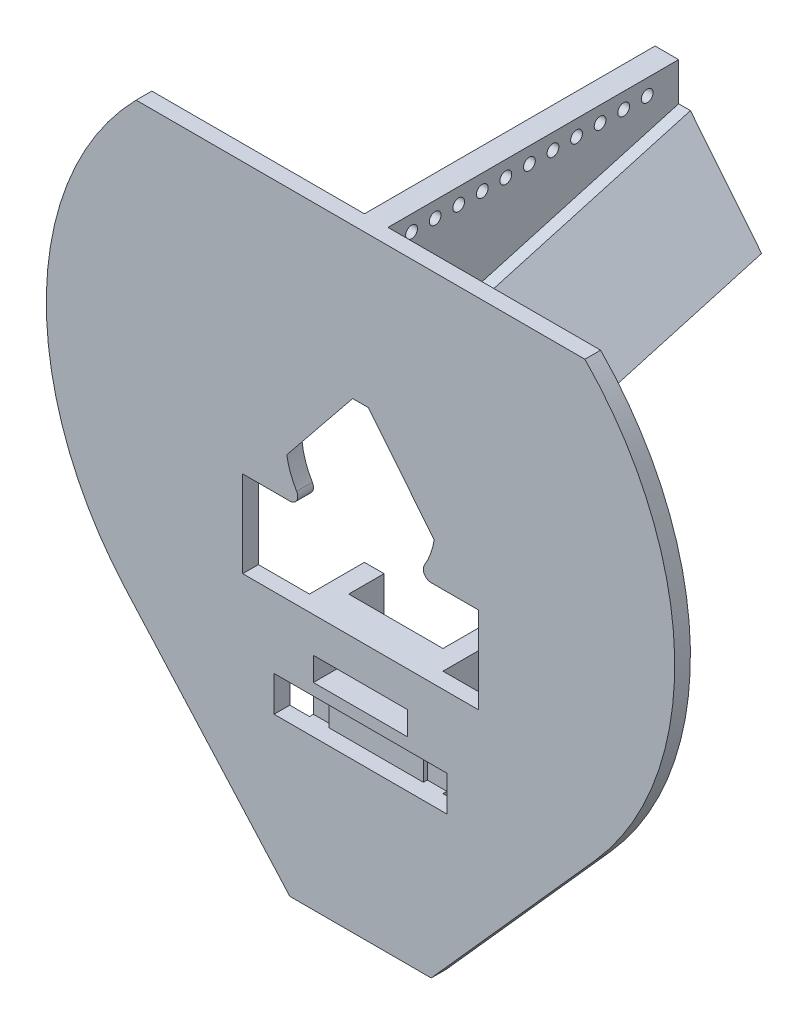
from build123d import *

# Parameters (mm, degrees)
BOSS_EXTRUDE1_DEPTH             = 2
SKETCH2_R                       = 0.75
BOSS_EXTRUDE2_DEPTH             = 1.5
BOSS_EXTRUDE3_REACH             = 75.225
BOSS_EXTRUDE3_DIRECTION_2_REACH = 75.225
CUT_EXTRUDE1_DEPTH              = 16.5
SKETCH5_W                       = 2.5
SKETCH5_H                       = 22
BOSS_EXTRUDE4_DEPTH             = 7
SKETCH6_W                       = 12
SKETCH6_H                       = 3
SKETCH6_W_2                     = 22
SKETCH6_H_2                     = 4.5
CUT_EXTRUDE2_DEPTH              = 2.5
SKETCH7_W                       = 12
SKETCH7_H                       = 7
SKETCH7_H_2                     = 4.5
BOSS_EXTRUDE5_DEPTH             = 2.5
FILLET1_R                       = 4
FILLET2_R                       = 1


with BuildPart() as part:
    # Sketch1 → Boss-Extrude1 (new body)
    with BuildSketch(Plane.XY):
        with BuildLine():
            Line((-28.565713714, 28), (28.565713714, 28))
            ThreePointArc((28.565713714, 28), (39.988956848, 0.93985647), (29.849608312, -26.627070504))
            Line((29.849608312, -26.627070504), (9, -50))
            Line((9, -50), (-9, -50))
            Line((-9, -50), (-29.849608312, -26.627070504))
            ThreePointArc((-29.849608312, -26.627070504), (-39.988956848, 0.93985647), (-28.565713714, 28))
        make_face()
        with BuildLine():
            Line((7, -6.422616289), (15, -6.422616289))
            Line((15, -6.422616289), (15, -17.422616289))
            Line((15, -17.422616289), (-15, -17.422616289))
            Line((-15, -17.422616289), (-15, -6.422616289))
            Line((-15, -6.422616289), (-7, -6.422616289))
            ThreePointArc((-7, -6.422616289), (0, 9.5), (7, -6.422616289))
        make_face(mode=Mode.SUBTRACT)
    extrude(amount=BOSS_EXTRUDE1_DEPTH)

    # Sketch2 → Boss-Extrude2 (add, symmetric)
    with BuildSketch(Plane(origin=(0, 0, 0), x_dir=(0, 0, -1), z_dir=(1, 0, 0))):
        Polygon((0, 9.5), (37, 20), (37, 28), (0, 28), align=None)
        with Locations((3, 26)):
            Circle(SKETCH2_R, mode=Mode.SUBTRACT)
        with Locations((6, 26)):
            Circle(SKETCH2_R, mode=Mode.SUBTRACT)
        with Locations((9, 26)):
            Circle(SKETCH2_R, mode=Mode.SUBTRACT)
        with Locations((12, 26)):
            Circle(SKETCH2_R, mode=Mode.SUBTRACT)
        with Locations((15, 26)):
            Circle(SKETCH2_R, mode=Mode.SUBTRACT)
        with Locations((18, 26)):
            Circle(SKETCH2_R, mode=Mode.SUBTRACT)
        with Locations((21, 26)):
            Circle(SKETCH2_R, mode=Mode.SUBTRACT)
        with Locations((24, 26)):
            Circle(SKETCH2_R, mode=Mode.SUBTRACT)
        with Locations((27, 26)):
            Circle(SKETCH2_R, mode=Mode.SUBTRACT)
        with Locations((30, 26)):
            Circle(SKETCH2_R, mode=Mode.SUBTRACT)
        with Locations((33, 26)):
            Circle(SKETCH2_R, mode=Mode.SUBTRACT)
    extrude(amount=BOSS_EXTRUDE2_DEPTH, both=True)

    # Boss-Extrude3: up to this plane
    boss_extrude3_end = Plane(origin=(1.5, 20, -37), z_dir=(0, 0, 1))
    # Sketch3 → Boss-Extrude3 (add, up to the surface)
    with BuildSketch(Plane(origin=(0, 0.708044617, -2.495014365), x_dir=(1, 0, 0), z_dir=(0, -0.27300368557463345, 0.9620129872629926)), mode=Mode.PRIVATE) as boss_extrude3_sk1:
        Polygon((1, 9.088350078), (-1, 9.088350078), (-9.380481154, -0.899118445), (-12.061636705, 1.350638189), (-3, 12.149876287), (3, 12.149876287), (12.061636705, 1.350638189), (9.380481154, -0.899118445), align=None)
    boss_extrude3_tool1 = split(extrude(boss_extrude3_sk1.sketch, amount=-BOSS_EXTRUDE3_REACH, mode=Mode.PRIVATE), bisect_by=boss_extrude3_end, keep=Keep.BOTH, mode=Mode.PRIVATE)
    add(boss_extrude3_tool1.solids().sort_by_distance((0, 9.715001, 0.061014))[0])

    # Boss-Extrude3 direction 2: up to this plane
    boss_extrude3_direction_2_end = Plane(origin=(0, 0, 2), z_dir=(0, 0, 1))
    # Sketch3 → Boss-Extrude3 direction 2 (add, up to the surface)
    with BuildSketch(Plane(origin=(0, 0.708044617, -2.495014365), x_dir=(1, 0, 0), z_dir=(0, -0.27300368557463345, 0.9620129872629926)), mode=Mode.PRIVATE) as boss_extrude3_direction_2_sk1:
        Polygon((1, 9.088350078), (-1, 9.088350078), (-9.380481154, -0.899118445), (-12.061636705, 1.350638189), (-3, 12.149876287), (3, 12.149876287), (12.061636705, 1.350638189), (9.380481154, -0.899118445), align=None)
    boss_extrude3_direction_2_tool1 = split(extrude(boss_extrude3_direction_2_sk1.sketch, amount=BOSS_EXTRUDE3_DIRECTION_2_REACH, mode=Mode.PRIVATE), bisect_by=boss_extrude3_direction_2_end, keep=Keep.BOTH, mode=Mode.PRIVATE)
    add(boss_extrude3_direction_2_tool1.solids().sort_by_distance((0, 9.715001, 0.061014))[0])

    # Sketch4 → Cut-Extrude1 (cut, symmetric)
    with BuildSketch(Plane(origin=(0, 0, 0), x_dir=(0, 0, -1), z_dir=(1, 0, 0))):
        Polygon((20.376494071, 1.70865423), (25.234329822, 8.565064446), (31.144411196, 4.377712218), align=None)
    extrude(amount=CUT_EXTRUDE1_DEPTH, both=True, mode=Mode.SUBTRACT)

    # Sketch5 → Boss-Extrude4 (add)
    with BuildSketch(Plane(origin=(0, 0, 0), x_dir=(-1, 0, 0), z_dir=(0, 0, -1))):
        with Locations((-7.25, -28.422616289)):
            Rectangle(SKETCH5_W, SKETCH5_H)
        with Locations((7.25, -28.422616289)):
            Rectangle(SKETCH5_W, SKETCH5_H)
    extrude(amount=BOSS_EXTRUDE4_DEPTH)

    # Sketch6 → Cut-Extrude2 (cut)
    with BuildSketch(Plane.XY.offset(2)):
        with Locations((0, -23.422616289)):
            Rectangle(SKETCH6_W, SKETCH6_H)
        with Locations((0, -28.672616289)):
            Rectangle(SKETCH6_W_2, SKETCH6_H_2)
    extrude(amount=-CUT_EXTRUDE2_DEPTH, mode=Mode.SUBTRACT)

    # Sketch7 → Boss-Extrude5 (add)
    with BuildSketch(Plane(origin=(0, 0, 0), x_dir=(-1, 0, 0), z_dir=(0, 0, -1))):
        with Locations((0, -28.422616289)):
            Rectangle(SKETCH7_W, SKETCH7_H)
        with Locations((0, -19.672616289)):
            Rectangle(SKETCH7_W, SKETCH7_H_2)
    extrude(amount=BOSS_EXTRUDE5_DEPTH)

    # Fillet1
    # the kernel refuses this fillet: 4 mm, written as the material it adds along each edge
    with BuildSketch(Plane(origin=(-6, -31.922616289, 0), x_dir=(0, 0, -1), z_dir=(1, 0, 0))) as fillet1_piece_1:
        with BuildLine():
            CenterArc((4, -3.708099244), FILLET1_R, 112.024312837, 67.975687163)
            Line((0, -3.708099244), (-0.08, -3.708099244))
            Line((-0.08, -3.708099244), (-0.08, 0))
            Line((-0.08, 0), (0, 0.08))
            ThreePointArc((0, 0.08), (1.25, 0.08), (2.47, 0.074161985))
            Line((2.47, 0.074161985), (2.5, 0))
        make_face()
    extrude(amount=12)

    # Fillet2
    fillet2_edges = [part.edges().sort_by_distance(p)[0] for p in [
        (7, -6.422616289, 1),
        (-7, -6.422616289, 1),
    ]]
    fillet(fillet2_edges, radius=FILLET2_R)


solid = part.part
